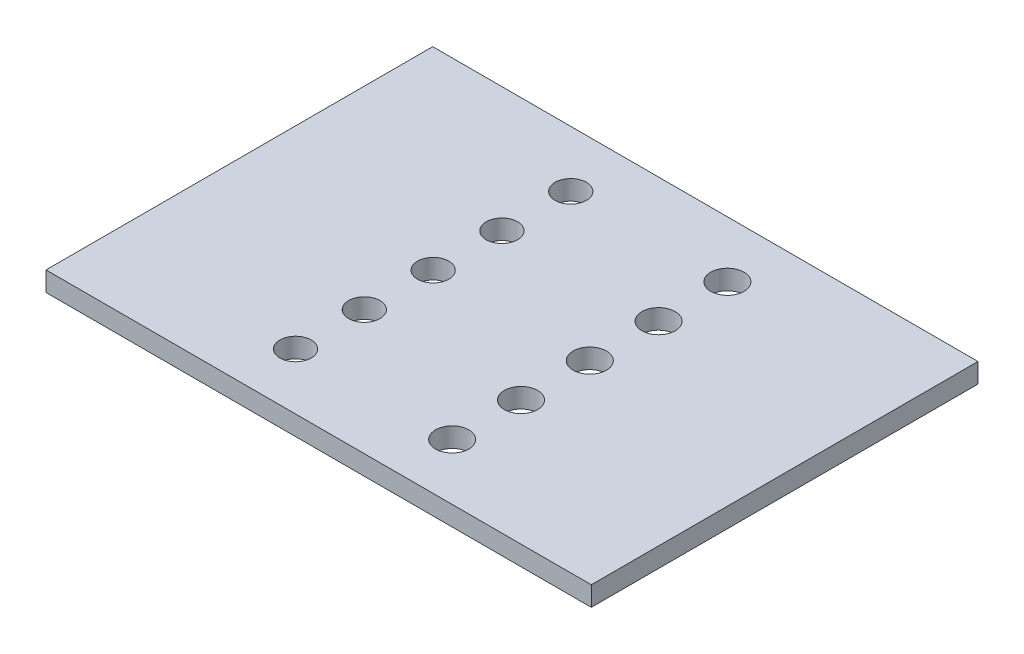
from build123d import *

# Parameters (mm, degrees)
SKETCH1_W           = 55.7
SKETCH1_H           = 39.5
BOSS_EXTRUDE1_DEPTH = 2
SKETCH2_R           = 1.6
SKETCH2_R_2         = 1.7
CUT_EXTRUDE2_DEPTH  = 35.200657888


with BuildPart() as part:
    # Sketch1 → Boss-Extrude1 (new body)
    with BuildSketch(Plane(origin=(0, 0, 0), x_dir=(1, 0, 0), z_dir=(0, 1, 0))):
        Rectangle(SKETCH1_W, SKETCH1_H)
    extrude(amount=BOSS_EXTRUDE1_DEPTH)

    # Sketch2 → Cut-Extrude2 (cut, through all)
    with BuildSketch(Plane(origin=(0, 2, 0), x_dir=(1, 0, 0), z_dir=(0, 1, 0))):
        with Locations((-8, 14)):
            Circle(SKETCH2_R)
        with Locations((8, 14)):
            Circle(SKETCH2_R_2)
        with Locations((7.972701567, 7.000053229)):
            Circle(SKETCH2_R_2)
        with Locations((-8.027298433, 7.000053229)):
            Circle(SKETCH2_R)
        with Locations((7.945403135, 0.000106458)):
            Circle(SKETCH2_R_2)
        with Locations((-8.054596865, 0.000106458)):
            Circle(SKETCH2_R)
        with Locations((7.918104702, -6.999840313)):
            Circle(SKETCH2_R_2)
        with Locations((-8.081895298, -6.999840313)):
            Circle(SKETCH2_R)
        with Locations((7.89080627, -13.999787084)):
            Circle(SKETCH2_R_2)
        with Locations((-8.10919373, -13.999787084)):
            Circle(SKETCH2_R)
    extrude(amount=-CUT_EXTRUDE2_DEPTH, mode=Mode.SUBTRACT)


solid = part.part
